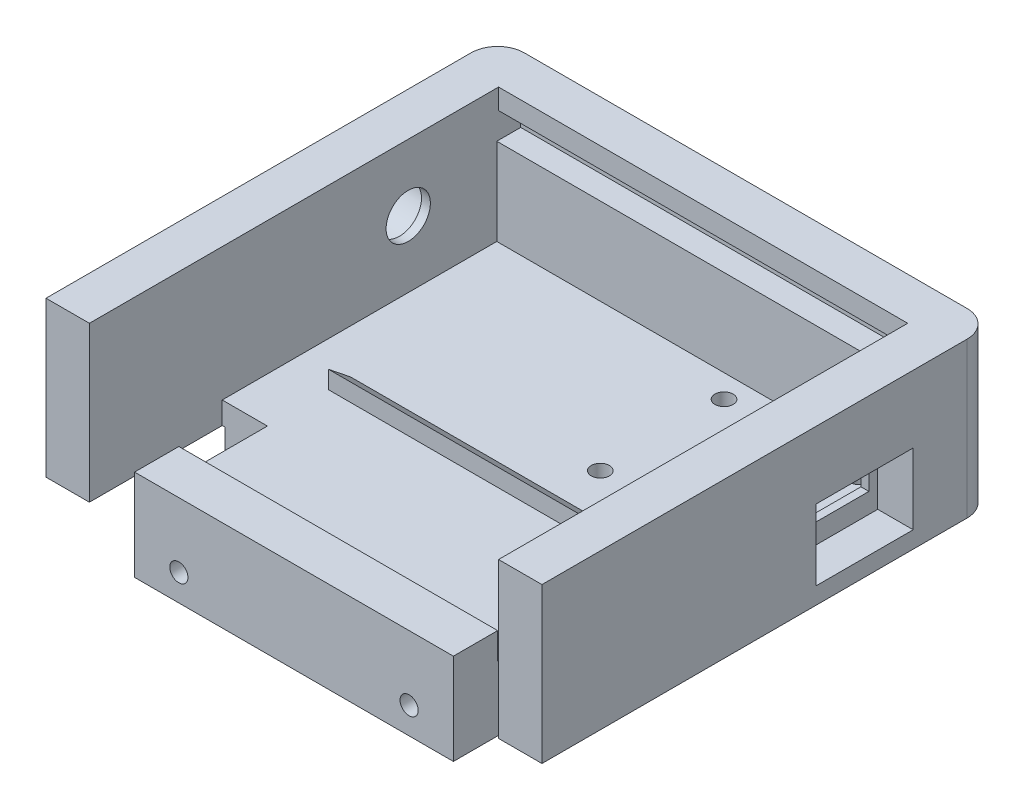
from build123d import *

# Parameters (mm, degrees)
SKETCH1_W                    = 46
SKETCH1_H                    = 46
BOSS_EXTRUDE1_DEPTH          = 2.5
SKETCH2_W                    = 46
SKETCH2_H                    = 48.5
BOSS_EXTRUDE2_DEPTH          = 2.5
SKETCH5_W                    = 56
SKETCH5_H                    = 51
BOSS_EXTRUDE5_DEPTH          = 2.5
SKETCH6_W                    = 56
SKETCH6_H                    = 51
SKETCH6_W_2                  = 46
SKETCH6_H_2                  = 41
BOSS_EXTRUDE6_DEPTH          = 15
M2_5X0_45_TAPPED_HOLE1_D     = 2.05
M2_5X0_45_TAPPED_HOLE1_DEPTH = 4
M2_5X0_45_TAPPED_HOLE1_TIP   = 0.615882135
F_5_0MM_DOWEL_HOLE1_D        = 5
F_5_0MM_DOWEL_HOLE1_DEPTH    = 6.35
F_5_0MM_DOWEL_HOLE1_TIP      = 1.502151548
F_8_0MM_DOWEL_HOLE1_D        = 8
F_8_0MM_DOWEL_HOLE1_DEPTH    = 3
F_8_0MM_DOWEL_HOLE1_TIP      = 2.403442476
SKETCH15_W                   = 5
SKETCH15_H                   = 22.5
CUT_EXTRUDE1_DEPTH           = 15
SKETCH16_W                   = 46
SKETCH16_H                   = 2.5
CUT_EXTRUDE2_DEPTH           = 2.5
FILLET1_R                    = 3
MOVE_FACE1_BY                = 0.2
MOVE_FACE1_2_BY              = 0.2
MOVE_FACE1_3_BY              = 0.2
MOVE_FACE1_4_BY              = 0.2
MOVE_FACE1_5_BY              = 0.2
MOVE_FACE1_6_BY              = 0.2
MOVE_FACE1_7_BY              = 0.2
MOVE_FACE1_8_BY              = 0.2
MOVE_FACE2_BY                = 0.2
MOVE_FACE2_2_BY              = 0.2
M2_5X0_45_TAPPED_HOLE2_D     = 2.05
M2_5X0_45_TAPPED_HOLE2_DEPTH = 5
M2_5X0_45_TAPPED_HOLE2_TIP   = 0.615882135
SKETCH20_W                   = 9
SKETCH20_H                   = 3.5
CUT_EXTRUDE4_DEPTH           = 75.846509605
SKETCH21_W                   = 11
SKETCH21_H                   = 8
CUT_EXTRUDE5_DEPTH           = 4
MOVE_START                   = -0.1
MOVE_FACE3_OUTLINE_R         = 2.5
MOVE_FACE3_DEPTH             = 0.1
MOVE_START_2                 = 46
MOVE_FACE3_2_OUTLINE_W       = 3.5
MOVE_FACE3_2_OUTLINE_H       = 9
MOVE_FACE3_2_DEPTH           = 0.1
SKETCH17_W                   = 36
SKETCH17_H                   = 5
CUT_EXTRUDE7_DEPTH           = 12
BOSS_EXTRUDE7_START          = 5
BOSS_EXTRUDE7_DEPTH          = 36.1


# Read off the part's stored shape, not the designer's step: Move Face3
with BuildPart() as part:
    # Sketch1 → Boss-Extrude1 (new body)
    with BuildSketch(Plane(origin=(0, 0, 0), x_dir=(1, 0, 0), z_dir=(0, 1, 0))):
        with Locations((23, 23)):
            Rectangle(SKETCH1_W, SKETCH1_H)
    extrude(amount=BOSS_EXTRUDE1_DEPTH)

    # Sketch2 → Boss-Extrude2 (add)
    with BuildSketch(Plane.XZ):
        with Locations((23, -24.25)):
            Rectangle(SKETCH2_W, SKETCH2_H)
    extrude(amount=BOSS_EXTRUDE2_DEPTH)

    # Sketch5 → Boss-Extrude5 (add)
    with BuildSketch(Plane(origin=(0, 2.5, 0), x_dir=(1, 0, 0), z_dir=(0, 1, 0))):
        with Locations((23, 25.5)):
            Rectangle(SKETCH5_W, SKETCH5_H)
    extrude(amount=BOSS_EXTRUDE5_DEPTH)

    # Sketch6 → Boss-Extrude6 (add)
    with BuildSketch(Plane(origin=(0, 5, 0), x_dir=(1, 0, 0), z_dir=(0, 1, 0))):
        with Locations((23, 25.5)):
            Rectangle(SKETCH6_W, SKETCH6_H)
        with Locations((23, 25.5)):
            Rectangle(SKETCH6_W_2, SKETCH6_H_2, mode=Mode.SUBTRACT)
    extrude(amount=BOSS_EXTRUDE6_DEPTH)

    # M2.5x0.45 Tapped Hole1
    with Locations(Plane(origin=(0, 5, 0), x_dir=(1, 0, 0), z_dir=(0, 1, 0))):
        with Locations((43.4, 43.4), (28.16, 43.4), (28.16, 29.43), (43.4, 29.43)):
            Hole(M2_5X0_45_TAPPED_HOLE1_D / 2, depth=M2_5X0_45_TAPPED_HOLE1_DEPTH)
            with Locations((0, 0, -(M2_5X0_45_TAPPED_HOLE1_DEPTH + M2_5X0_45_TAPPED_HOLE1_TIP / 2))):  # 118° drill point
                Cone(0, M2_5X0_45_TAPPED_HOLE1_D / 2, M2_5X0_45_TAPPED_HOLE1_TIP, mode=Mode.SUBTRACT)

    # Ø5.0mm Dowel Hole1
    with Locations(Plane(origin=(0, 0, 0), x_dir=(0, 0, -1), z_dir=(1, 0, 0))):
        with Locations((36, 12.5)):
            Hole(F_5_0MM_DOWEL_HOLE1_D / 2, depth=F_5_0MM_DOWEL_HOLE1_DEPTH)
            with Locations((0, 0, -(F_5_0MM_DOWEL_HOLE1_DEPTH + F_5_0MM_DOWEL_HOLE1_TIP / 2))):  # 118° drill point
                Cone(0, F_5_0MM_DOWEL_HOLE1_D / 2, F_5_0MM_DOWEL_HOLE1_TIP, mode=Mode.SUBTRACT)

    # Ø8.0mm Dowel Hole1
    with Locations(Plane.ZY.offset(5)):
        with Locations((-36, 12.5)):
            Hole(F_8_0MM_DOWEL_HOLE1_D / 2, depth=F_8_0MM_DOWEL_HOLE1_DEPTH)
            with Locations((0, 0, -(F_8_0MM_DOWEL_HOLE1_DEPTH + F_8_0MM_DOWEL_HOLE1_TIP / 2))):  # 118° drill point
                Cone(0, F_8_0MM_DOWEL_HOLE1_D / 2, F_8_0MM_DOWEL_HOLE1_TIP, mode=Mode.SUBTRACT)

    # Sketch15 → Cut-Extrude1 (cut)
    with BuildSketch(Plane.XY):
        with Locations((43.5, 8.75)):
            Rectangle(SKETCH15_W, SKETCH15_H)
        with Locations((2.5, 8.75)):
            Rectangle(SKETCH15_W, SKETCH15_H)
    extrude(amount=-CUT_EXTRUDE1_DEPTH, mode=Mode.SUBTRACT)

    # Sketch16 → Cut-Extrude2 (cut)
    with BuildSketch(Plane.XY.offset(-46)):
        with Locations((23, 16.25)):
            Rectangle(SKETCH16_W, SKETCH16_H)
    extrude(amount=-CUT_EXTRUDE2_DEPTH, mode=Mode.SUBTRACT)

    # Fillet1
    fillet1_edges = [part.edges().sort_by_distance(p)[0] for p in [
        (-5, 11.25, -51),
        (51, 11.25, -51),
    ]]
    fillet(fillet1_edges, radius=FILLET1_R)

    # Move Face1: a face moved inward by 0.2
    extrude(part.faces().sort_by_distance((23, -2.5, -25.457352235))[0], amount=MOVE_FACE1_BY, dir=(0, 1, 0), mode=Mode.SUBTRACT)

    # Move Face1 2: a face moved inward by 0.2
    extrude(part.faces().sort_by_distance((23, 16.25, -48.5))[0], amount=MOVE_FACE1_2_BY, dir=(0, 0, -1), mode=Mode.SUBTRACT)

    # Move Face1 3: a face moved inward by 0.2
    extrude(part.faces().sort_by_distance((23, 17.5, -47.25))[0], amount=MOVE_FACE1_3_BY, dir=(0, 1, 0), mode=Mode.SUBTRACT)

    # Move Face1 4: a face moved inward by 0.2
    extrude(part.faces().sort_by_distance((23, 18.75, -46))[0], amount=MOVE_FACE1_4_BY, dir=(0, 0, -1), mode=Mode.SUBTRACT)

    # Move Face1 5: a face moved inward by 0.2
    extrude(part.faces().sort_by_distance((23, 0, -47.25))[0], amount=MOVE_FACE1_5_BY, dir=(0, -1, 0), mode=Mode.SUBTRACT)

    # Move Face1 6: a face moved inward by 0.2
    extrude(part.faces().sort_by_distance((23, 1.25, -46))[0], amount=MOVE_FACE1_6_BY, dir=(0, 0, 1), mode=Mode.SUBTRACT)

    # Move Face1 7: a face moved inward by 0.2
    extrude(part.faces().sort_by_distance((23, -1.25, -48.5))[0], amount=MOVE_FACE1_7_BY, dir=(0, 0, 1), mode=Mode.SUBTRACT)

    # Move Face1 8: a face moved inward by 0.2
    extrude(part.faces().sort_by_distance((23, 15, -47.25))[0], amount=MOVE_FACE1_8_BY, dir=(0, -1, 0), mode=Mode.SUBTRACT)

    # Move Face2: a face moved inward by 0.2
    extrude(part.faces().sort_by_distance((46, 0.053703704, -30.970987654))[0], amount=MOVE_FACE2_BY, dir=(-1, 0, 0), mode=Mode.SUBTRACT)

    # Move Face2 2: a face moved inward by 0.2
    extrude(part.faces().sort_by_distance((0, 0.053703704, -30.970987654))[0], amount=MOVE_FACE2_2_BY, dir=(1, 0, 0), mode=Mode.SUBTRACT)

    # M2.5x0.45 Tapped Hole2
    with Locations(Plane.XY):
        with Locations((10, 0.7), (36, 0.7)):
            Hole(M2_5X0_45_TAPPED_HOLE2_D / 2, depth=M2_5X0_45_TAPPED_HOLE2_DEPTH)
            with Locations((0, 0, -(M2_5X0_45_TAPPED_HOLE2_DEPTH + M2_5X0_45_TAPPED_HOLE2_TIP / 2))):  # 118° drill point
                Cone(0, M2_5X0_45_TAPPED_HOLE2_D / 2, M2_5X0_45_TAPPED_HOLE2_TIP, mode=Mode.SUBTRACT)

    # Sketch20 → Cut-Extrude4 (cut, through all)
    with BuildSketch(Plane.ZY.offset(-46)):
        with Locations((-36.415, 8.4)):
            Rectangle(SKETCH20_W, SKETCH20_H)
    extrude(amount=-CUT_EXTRUDE4_DEPTH, mode=Mode.SUBTRACT)

    # Sketch21 → Cut-Extrude5 (cut)
    with BuildSketch(Plane(origin=(51, 0, 0), x_dir=(0, 0, -1), z_dir=(1, 0, 0))):
        with Locations((36.415, 8.4)):
            Rectangle(SKETCH21_W, SKETCH21_H)
    extrude(amount=-CUT_EXTRUDE5_DEPTH, mode=Mode.SUBTRACT)

    # Move Face3 outline → Move Face3 (cut)
    with BuildSketch(Plane.YZ.offset(MOVE_START)):
        Polygon((5, -46), (14.8, -46), (14.8, -48.7), (17.7, -48.7), (17.7, -46.2), (20, -46.2), (20, 0), (2.5, 0), (2.5, -15), (5, -15), align=None)
        with Locations((12.5, -36)):
            Circle(MOVE_FACE3_OUTLINE_R, mode=Mode.SUBTRACT)
    extrude(amount=MOVE_FACE3_DEPTH, mode=Mode.SUBTRACT)

    # Move Face3 2 outline → Move Face3 2 (cut)
    with BuildSketch(Plane.YZ.offset(MOVE_START_2)):
        Polygon((5, -46), (14.8, -46), (14.8, -48.7), (17.7, -48.7), (17.7, -46.2), (20, -46.2), (20, 0), (2.5, 0), (2.5, -15), (5, -15), align=None)
        with Locations((8.4, -36.415)):
            Rectangle(MOVE_FACE3_2_OUTLINE_W, MOVE_FACE3_2_OUTLINE_H, mode=Mode.SUBTRACT)
    extrude(amount=MOVE_FACE3_2_DEPTH, mode=Mode.SUBTRACT)

    # Sketch17 → Cut-Extrude7 (cut)
    with BuildSketch(Plane(origin=(0, 20, 0), x_dir=(1, 0, 0), z_dir=(0, 1, 0))):
        with Locations((23, 2.5)):
            Rectangle(SKETCH17_W, SKETCH17_H)
    extrude(amount=-CUT_EXTRUDE7_DEPTH, mode=Mode.SUBTRACT)

    # Sketch8 → Boss-Extrude7 (add)
    with BuildSketch(Plane.ZY.offset(-46).offset(BOSS_EXTRUDE7_START)):
        Polygon((-22, 5), (-24.5, 5), (-22, 7), align=None)
    extrude(amount=BOSS_EXTRUDE7_DEPTH)


solid = part.part
